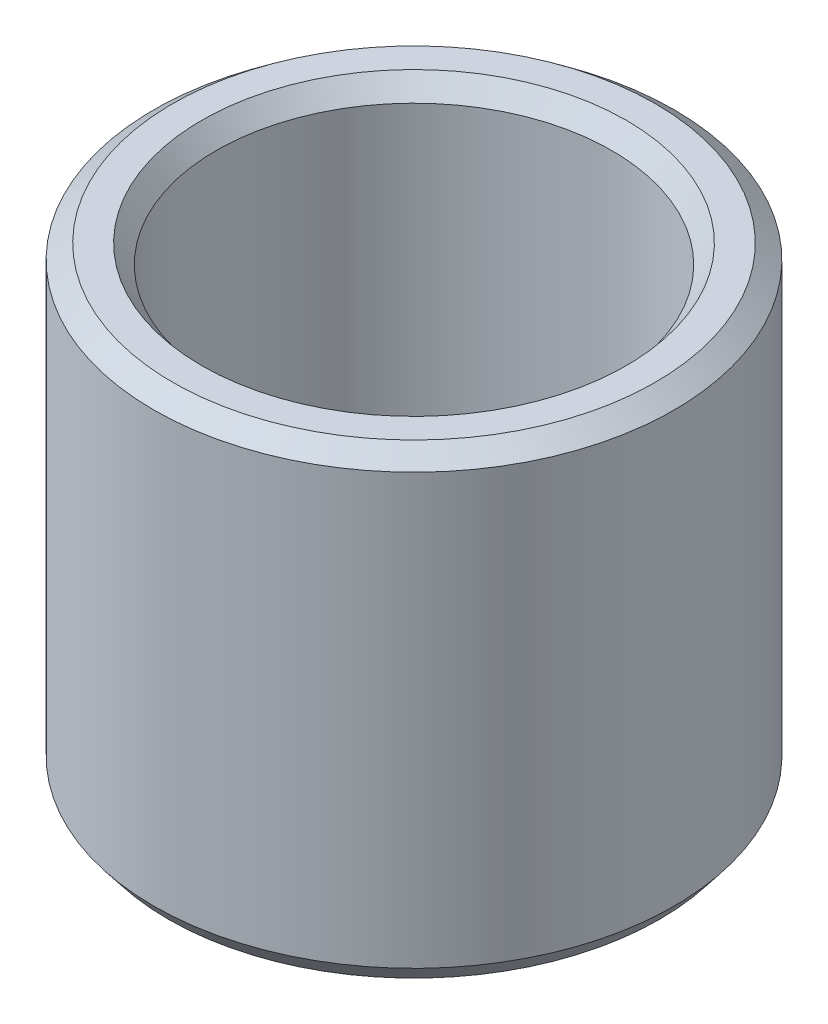
from build123d import *
from OCP.BRepFilletAPI import BRepFilletAPI_MakeChamfer

# Parameters (mm, degrees)
SKETCH1_R           = 42.5
BOSS_EXTRUDE1_DEPTH = 75.651781565
SKETCH2_R           = 32.316988098
CUT_EXTRUDE1_DEPTH  = 97.621385076
CHAMFER1_SIZE       = 2.387354077
CHAMFER1_SIZE2      = 3.069703523


with BuildPart() as part:
    # Sketch1 → Boss-Extrude1 (new body)
    with BuildSketch(Plane(origin=(0, 0, 0), x_dir=(1, 0, 0), z_dir=(0, 1, 0))):
        Circle(SKETCH1_R)
    extrude(amount=BOSS_EXTRUDE1_DEPTH)

    # Sketch2 → Cut-Extrude1 (cut, through all)
    with BuildSketch(Plane(origin=(0, 0, 0), x_dir=(1, 0, 0), z_dir=(0, 1, 0))):
        Circle(SKETCH2_R)
    extrude(amount=CUT_EXTRUDE1_DEPTH, mode=Mode.SUBTRACT)

    # Chamfer1: one chamfer whose edges measure the first distance from different faces: ONE call of the kernel's chamfer builder (chamfer() names one face for all edges)
    chamfer1_edges_1 = [part.edges().sort_by_distance(p)[0] for p in [
        (-32.316988098, 75.651781565, 0),
    ]]
    chamfer1_side_1 = [part.faces().sort_by_distance(p)[0] for p in [
        (-41.297918472, 75.651781565, 0),
    ]]
    chamfer1_edges_2 = [part.edges().sort_by_distance(p)[0] for p in [
        (-32.316988098, 0, 0),
    ]]
    chamfer1_side_2 = [part.faces().sort_by_distance(p)[0] for p in [
        (-32.316988098, 37.825890783, 0),
    ]]
    chamfer1_edges_3 = [part.edges().sort_by_distance(p)[0] for p in [
        (-42.5, 0, 0),
    ]]
    chamfer1_side_3 = [part.faces().sort_by_distance(p)[0] for p in [
        (-41.297918472, 0, 0),
    ]]
    chamfer1_edges_4 = [part.edges().sort_by_distance(p)[0] for p in [
        (-42.5, 75.651781565, 0),
    ]]
    chamfer1_side_4 = [part.faces().sort_by_distance(p)[0] for p in [
        (-42.5, 37.825890783, 0),
    ]]
    chamfer1 = BRepFilletAPI_MakeChamfer(part.part.solid().wrapped)
    for e in chamfer1_edges_1:
        chamfer1.Add(CHAMFER1_SIZE, CHAMFER1_SIZE2, e.wrapped, chamfer1_side_1[0].wrapped)  # the first distance lies on this face
    for e in chamfer1_edges_2:
        chamfer1.Add(CHAMFER1_SIZE, CHAMFER1_SIZE2, e.wrapped, chamfer1_side_2[0].wrapped)  # the first distance lies on this face
    for e in chamfer1_edges_3:
        chamfer1.Add(CHAMFER1_SIZE, CHAMFER1_SIZE2, e.wrapped, chamfer1_side_3[0].wrapped)  # the first distance lies on this face
    for e in chamfer1_edges_4:
        chamfer1.Add(CHAMFER1_SIZE, CHAMFER1_SIZE2, e.wrapped, chamfer1_side_4[0].wrapped)  # the first distance lies on this face
    add(Compound.cast(chamfer1.Shape()), mode=Mode.REPLACE)


solid = part.part
